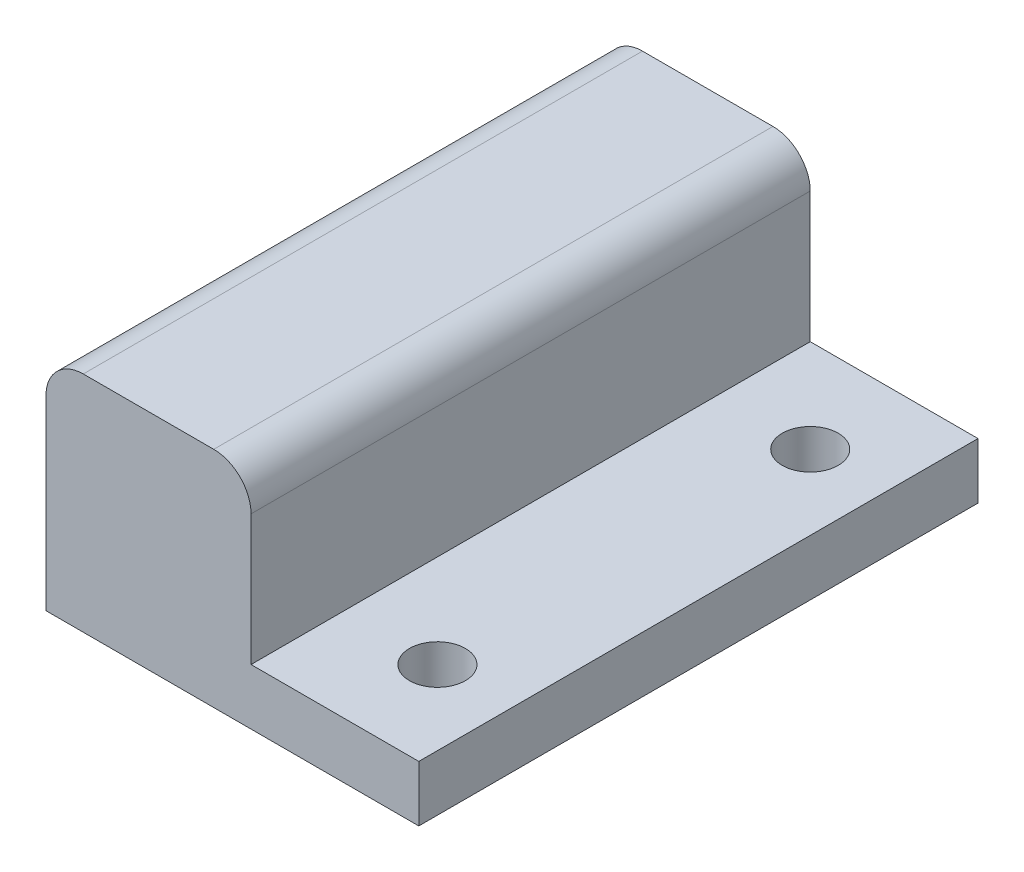
from build123d import *

# Parameters (mm, degrees)
SKETCH1_W           = 25.4
SKETCH1_H           = 38.1
SKETCH1_R           = 1.905
BOSS_EXTRUDE1_DEPTH = 3.81
BOSS_EXTRUDE2_DEPTH = 8.89
SKETCH3_W           = 13.97
SKETCH3_H           = 38.1
BOSS_EXTRUDE3_DEPTH = 2.54
CHAMFER1_SIZE       = 1.27
FILLET2_R           = 2.54


with BuildPart() as part:
    # Sketch1 → Boss-Extrude1 (new body)
    with BuildSketch(Plane(origin=(0, 0, 0), x_dir=(1, 0, 0), z_dir=(0, 1, 0))):
        with Locations((-7.62, -12.7)):
            Rectangle(SKETCH1_W, SKETCH1_H)
        Circle(SKETCH1_R, mode=Mode.SUBTRACT)
        with Locations((0, -25.4)):
            Circle(SKETCH1_R, mode=Mode.SUBTRACT)
    extrude(amount=BOSS_EXTRUDE1_DEPTH)

    # Sketch2 → Boss-Extrude2 (add)
    with BuildSketch(Plane(origin=(0, 3.81, 0), x_dir=(1, 0, 0), z_dir=(0, 1, 0))):
        Polygon((-20.32, 6.35), (-20.32, -31.75), (-6.35, -31.75), (-6.35, 6.35), (-8.89, 6.35), (-8.89, -29.21), (-17.78, -29.21), (-17.78, 6.35), align=None)
    extrude(amount=BOSS_EXTRUDE2_DEPTH)

    # Sketch3 → Boss-Extrude3 (add)
    with BuildSketch(Plane(origin=(0, 12.7, 0), x_dir=(1, 0, 0), z_dir=(0, 1, 0))):
        with Locations((-13.335, -12.7)):
            Rectangle(SKETCH3_W, SKETCH3_H)
    extrude(amount=BOSS_EXTRUDE3_DEPTH)

    # Chamfer1
    chamfer1_edges = [part.edges().sort_by_distance(p)[0] for p in [
        (-8.89, 12.7, 11.43),
        (-17.78, 12.7, 11.43),
    ]]
    chamfer(chamfer1_edges, length=CHAMFER1_SIZE)

    # Fillet2
    fillet2_edges = [part.edges().sort_by_distance(p)[0] for p in [
        (-6.35, 15.24, 12.7),
        (-20.32, 15.24, 12.7),
    ]]
    fillet(fillet2_edges, radius=FILLET2_R)


solid = part.part
